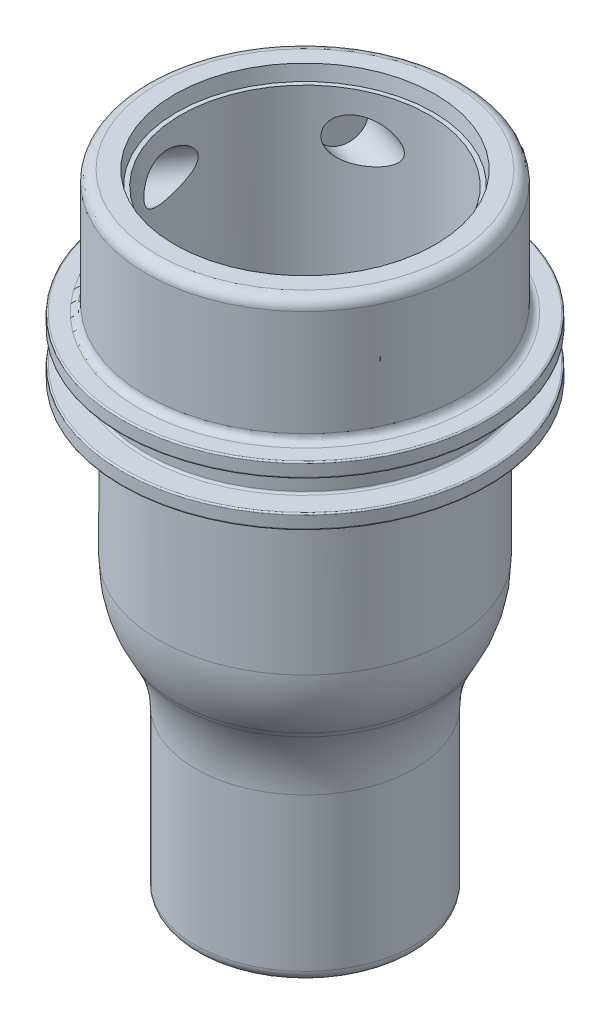
from build123d import *

# Parameters (mm, degrees)
O_RING_GLAND_R1_R     = 0.1778
O_RING_GLAND_R2_R     = 0.127
O_RING_GLAND_ROUNDS_R = 0.635
TOP_BOTTOM_ROUNDS_R   = 0.9525
FLOW_ROUNDS_R         = 10.795
SKETCH3_R             = 1.8669
CUT_EXTRUDE1_DEPTH    = 10.033
CIRPATTERN1_COUNT     = 5


with BuildPart() as part:
    # Sketch2 → Revolve1 (revolve)
    with BuildSketch(Plane.XY, mode=Mode.PRIVATE) as revolve1_sk:
        Polygon((7.62, 0), (7.62, 17.145), (10.795, 22.644261314), (10.795, 53.4162), (11.176, 53.4162), (11.343198672, 54.6862), (13.8176, 54.6862), (13.8176, 43.8912), (15.9385, 43.8912), (15.9385, 42.6212), (13.8176, 42.6212), (13.8176, 40.005), (15.9385, 40.005), (15.9385, 38.735), (12.7, 38.735), (12.7, 22.644261314), (9.525, 17.145), (9.525, 0), align=None)
    revolve(revolve1_sk.sketch.rotate(Axis((0, 0, 0), (0, 1, 0)), 90), axis=Axis((0, 0, 0), (0, 1, 0)))

    # O-Ring Gland R1
    o_ring_gland_r1_edges = [part.edges().sort_by_distance(p)[0] for p in [
        (0, 42.6212, 13.8176),
        (0, 40.005, 13.8176),
    ]]
    fillet(o_ring_gland_r1_edges, radius=O_RING_GLAND_R1_R)

    # O-Ring Gland R2
    o_ring_gland_r2_edges = [part.edges().sort_by_distance(p)[0] for p in [
        (0, 43.8912, 15.9385),
        (0, 42.6212, 15.9385),
        (0, 40.005, 15.9385),
        (0, 38.735, 15.9385),
    ]]
    fillet(o_ring_gland_r2_edges, radius=O_RING_GLAND_R2_R)

    # O-Ring Gland Rounds
    o_ring_gland_rounds_edges = [part.edges().sort_by_distance(p)[0] for p in [
        (0, 43.8912, 13.8176),
        (0, 38.735, 12.7),
    ]]
    fillet(o_ring_gland_rounds_edges, radius=O_RING_GLAND_ROUNDS_R)

    # Top/Bottom Rounds
    top_bottom_rounds_edges = [part.edges().sort_by_distance(p)[0] for p in [
        (0, 0, 7.62),
        (0, 54.6862, 13.8176),
        (0, 0, 9.525),
    ]]
    fillet(top_bottom_rounds_edges, radius=TOP_BOTTOM_ROUNDS_R - 0.0001)  # a hair under: the kernel refuses the full size

    # Flow Rounds
    flow_rounds_edges = [part.edges().sort_by_distance(p)[0] for p in [
        (0, 17.145, 7.62),
        (0, 22.644261314, 10.795),
        (0, 22.644261314, 12.7),
        (0, 17.145, 9.525),
    ]]
    fillet(flow_rounds_edges, radius=FLOW_ROUNDS_R)

    # Sketch3 → Cut-Extrude1 (cut)
    with BuildSketch(Plane.XY):
        with Locations((7.62, 49.6062)):
            Circle(SKETCH3_R)
    cut_extrude1 = extrude(amount=-CUT_EXTRUDE1_DEPTH, mode=Mode.SUBTRACT)

    # CirPattern1: Cut-Extrude1 ×5 about axis
    cirpattern1_axis = Axis((0, 0, 0), (0, 1, 0))
    for i in range(1, CIRPATTERN1_COUNT):
        add(cut_extrude1.rotate(cirpattern1_axis, i * 360 / CIRPATTERN1_COUNT), mode=Mode.SUBTRACT)


solid = part.part
